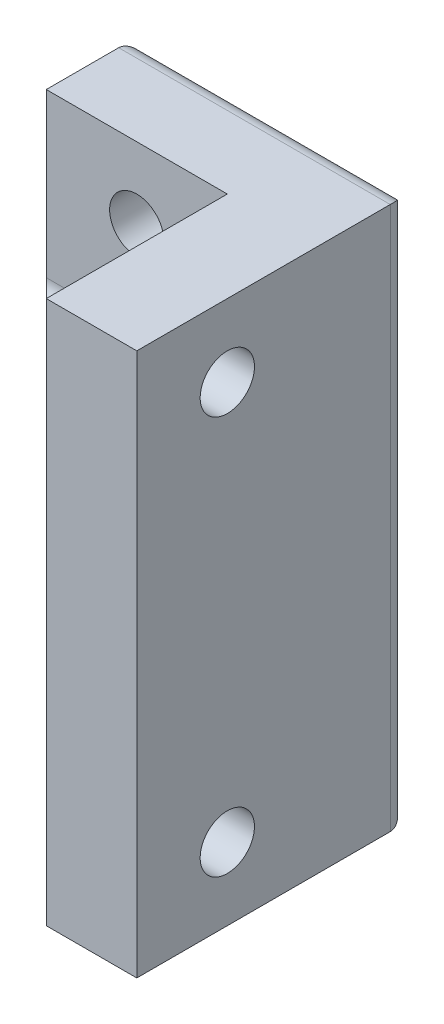
from build123d import *

# Parameters (mm, degrees)
SKETCH_1_W           = 10
SKETCH_1_H           = 30
EXTRUDE_1_DEPTH      = 5
SKETCH_2_W           = 15
SKETCH_2_H           = 30
EXTRUDE_2_DEPTH      = 5
SKETCH_4_R           = 1.5
CUT_EXTRUDE_1_DEPTH  = 21.615528128
EXTRUDE_3_DEPTH      = 5
EXTRUDE_3_DEPTH_BACK = 5
SKETCH_3_R           = 1.5
CUT_EXTRUDE_2_DEPTH  = 5
FILLET_1_R           = 1
FILLET_2_R           = 1


with BuildPart() as part:
    # 草圖1 → 填料-伸長1 (new body)
    with BuildSketch(Plane.XY):
        Rectangle(SKETCH_1_W, SKETCH_1_H)
    extrude(amount=EXTRUDE_1_DEPTH)

    # 草圖2 → 填料-伸長2 (add)
    with BuildSketch(Plane(origin=(5, 0, 0), x_dir=(0, 0, -1), z_dir=(1, 0, 0))):
        with Locations((-7.5, 0)):
            Rectangle(SKETCH_2_W, SKETCH_2_H)
    extrude(amount=EXTRUDE_2_DEPTH)

    # 草圖4 → 除料-伸長1 (cut, through all)
    with BuildSketch(Plane.XY.offset(5)):
        with Locations((0, 11)):
            Circle(SKETCH_4_R)
        with Locations((0, -11)):
            Circle(SKETCH_4_R)
    extrude(amount=-CUT_EXTRUDE_1_DEPTH, mode=Mode.SUBTRACT)

    # 草圖5 → 填料-伸長3 (add, two sides: drawn at the far end of the back side and taken through both)
    with BuildSketch(Plane.XZ.offset(-EXTRUDE_3_DEPTH_BACK)):
        Polygon((5, 15), (-5, 5), (5, 5), align=None)
    extrude(amount=EXTRUDE_3_DEPTH + EXTRUDE_3_DEPTH_BACK)

    # 草圖3 → 除料-伸長2 (cut)
    with BuildSketch(Plane.ZY.offset(-5)):
        with Locations(Location((10, 11, 0), (0, 0, 270))):
            Circle(SKETCH_3_R)
        with Locations(Location((10, -11, 0), (0, 0, 270))):
            Circle(SKETCH_3_R)
    extrude(amount=-CUT_EXTRUDE_2_DEPTH, mode=Mode.SUBTRACT)

    # 圓角1
    fillet_1_edges = [part.edges().sort_by_distance(p)[0] for p in [
        (10, 0, 0),
        (-1.5, 11, 0),
        (-1.5, -11, 0),
        (2.5, -15, 0),
        (-5, 0, 0),
        (2.5, 15, 0),
    ]]
    fillet(fillet_1_edges, radius=FILLET_1_R)

    # 圓角2
    # the kernel refuses this fillet: 1 mm, written as the material it adds along each edge
    with BuildSketch(Plane(origin=(-5, -5, 5), x_dir=(0, -1, 0), z_dir=(1, 0, 0))) as fillet_2_piece_1_section:
        with BuildLine():
            CenterArc((FILLET_2_R, -FILLET_2_R), FILLET_2_R, 90, 90)
            Line((0, -FILLET_2_R), (0, 0))
            Line((0, 0), (FILLET_2_R, 0))
        make_face()
    fillet_2_piece_1 = extrude(amount=12.5, mode=Mode.PRIVATE)
    fillet_2_piece_1 = split(fillet_2_piece_1, bisect_by=Plane(origin=(-2.333551082, -5.229183037, 7.666448918), z_dir=(0.7071067811865476, 0, -0.7071067811865475)), keep=Keep.TOP, mode=Mode.PRIVATE)
    add(fillet_2_piece_1)
    with BuildSketch(Plane(origin=(5, -5, 2.5), x_dir=(0, -1, 0), z_dir=(0, 0, 1))) as fillet_2_piece_2_section:
        with BuildLine():
            CenterArc((FILLET_2_R, -FILLET_2_R), FILLET_2_R, 90, 90)
            Line((0, -FILLET_2_R), (0, 0))
            Line((0, 0), (FILLET_2_R, 0))
        make_face()
    fillet_2_piece_2 = extrude(amount=12.5, mode=Mode.PRIVATE)
    fillet_2_piece_2 = split(fillet_2_piece_2, bisect_by=Plane(origin=(-0.738197557, -5.226395114, 9.261802443), z_dir=(0.7071067811865476, 0, -0.7071067811865475)), keep=Keep.TOP, mode=Mode.PRIVATE)
    add(fillet_2_piece_2)
    with BuildSketch(Plane(origin=(-5, 5, 5), x_dir=(0, 1, 0), z_dir=(1, 0, 0))) as fillet_2_piece_3_section:
        with BuildLine():
            CenterArc((FILLET_2_R, FILLET_2_R), FILLET_2_R, 180, 90)
            Line((0, FILLET_2_R), (0, 0))
            Line((0, 0), (FILLET_2_R, 0))
        make_face()
    fillet_2_piece_3 = extrude(amount=12.5, mode=Mode.PRIVATE)
    fillet_2_piece_3 = split(fillet_2_piece_3, bisect_by=Plane(origin=(-2.333551082, 5.229183037, 7.666448918), z_dir=(0.7071067811865476, 0, -0.7071067811865475)), keep=Keep.TOP, mode=Mode.PRIVATE)
    add(fillet_2_piece_3)
    with BuildSketch(Plane(origin=(5, 5, 2.5), x_dir=(0, 1, 0), z_dir=(0, 0, 1))) as fillet_2_piece_4_section:
        with BuildLine():
            CenterArc((FILLET_2_R, FILLET_2_R), FILLET_2_R, 180, 90)
            Line((0, FILLET_2_R), (0, 0))
            Line((0, 0), (FILLET_2_R, 0))
        make_face()
    fillet_2_piece_4 = extrude(amount=12.5, mode=Mode.PRIVATE)
    fillet_2_piece_4 = split(fillet_2_piece_4, bisect_by=Plane(origin=(-0.738197557, 5.226395114, 9.261802443), z_dir=(0.7071067811865476, 0, -0.7071067811865475)), keep=Keep.TOP, mode=Mode.PRIVATE)
    add(fillet_2_piece_4)


solid = part.part
